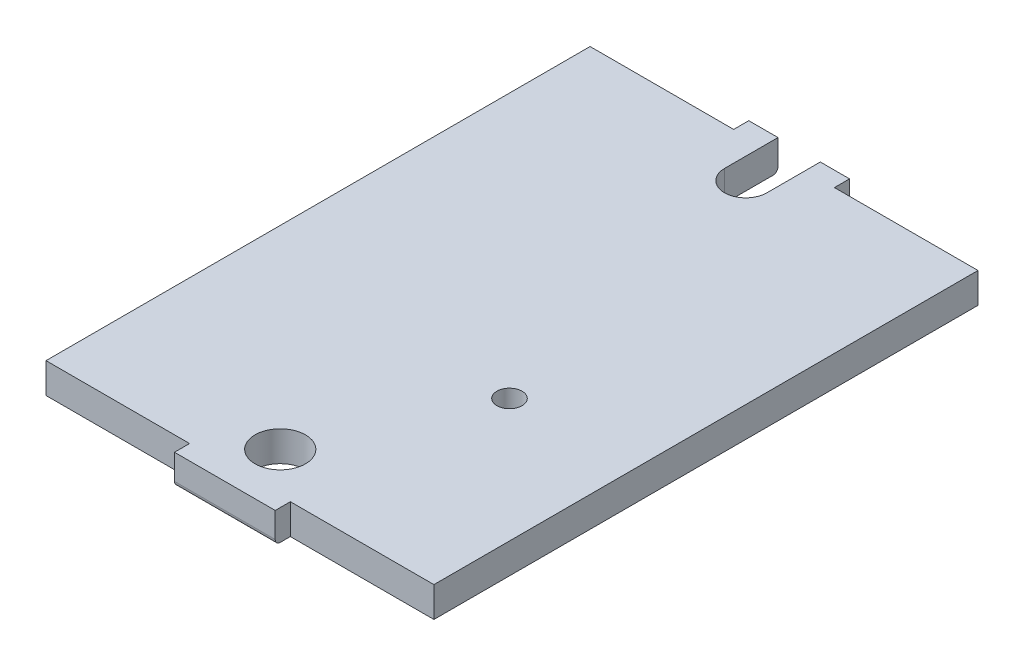
from build123d import *

# Parameters (mm, degrees)
BOSS_EXTRUDE1_DEPTH = 3
FILLET1_R           = 0.5
SKETCH2_R           = 2.5
CUT_EXTRUDE1_DEPTH  = 35.522637501
CUT_EXTRUDE2_DEPTH  = 35.522637501
SKETCH4_R           = 1.25
CUT_EXTRUDE3_DEPTH  = 35.522637501
CHAMFER1_SIZE       = 0.5


with BuildPart() as part:
    # Sketch1 → Boss-Extrude1 (new body)
    with BuildSketch(Plane(origin=(0, 0, 0), x_dir=(1, 0, 0), z_dir=(0, 1, 0))):
        Polygon((-19.25, 27), (-19.25, -27), (-5, -27), (-5, -28.5), (5, -28.5), (5, -27), (19.25, -27), (19.25, 27), (5, 27), (5, 28.5), (-5, 28.5), (-5, 27), align=None)
    extrude(amount=BOSS_EXTRUDE1_DEPTH)

    # Fillet1
    fillet1_edges = [part.edges().sort_by_distance(p)[0] for p in [
        (0, 0, -28.5),
        (0, 0, 28.5),
    ]]
    fillet(fillet1_edges, radius=FILLET1_R)

    # Sketch2 → Cut-Extrude1 (cut, through all)
    with BuildSketch(Plane(origin=(0, 3, 0), x_dir=(1, 0, 0), z_dir=(0, 1, 0))):
        with Locations((0, -23)):
            Circle(SKETCH2_R)
    extrude(amount=-CUT_EXTRUDE1_DEPTH, mode=Mode.SUBTRACT)

    # Sketch3 → Cut-Extrude2 (cut, through all)
    with BuildSketch(Plane(origin=(0, 3, 0), x_dir=(1, 0, 0), z_dir=(0, 1, 0))):
        with BuildLine():
            Line((-2.1, 28.5), (2.1, 28.5))
            Line((2.1, 28.5), (2.1, 23.2))
            ThreePointArc((2.1, 23.2), (0, 21.1), (-2.1, 23.2))
            Line((-2.1, 23.2), (-2.1, 28.5))
        make_face()
    extrude(amount=-CUT_EXTRUDE2_DEPTH, mode=Mode.SUBTRACT)

    # Sketch4 → Cut-Extrude3 (cut, through all)
    with BuildSketch(Plane(origin=(0, 3, 0), x_dir=(1, 0, 0), z_dir=(0, 1, 0))):
        with Locations((7, -7.25)):
            Circle(SKETCH4_R)
    extrude(amount=-CUT_EXTRUDE3_DEPTH, mode=Mode.SUBTRACT)

    # Chamfer1
    chamfer1_edges = [part.edges().sort_by_distance(p)[0] for p in [
        (5.75, 0, 7.25),
    ]]
    chamfer(chamfer1_edges, length=CHAMFER1_SIZE)


solid = part.part
